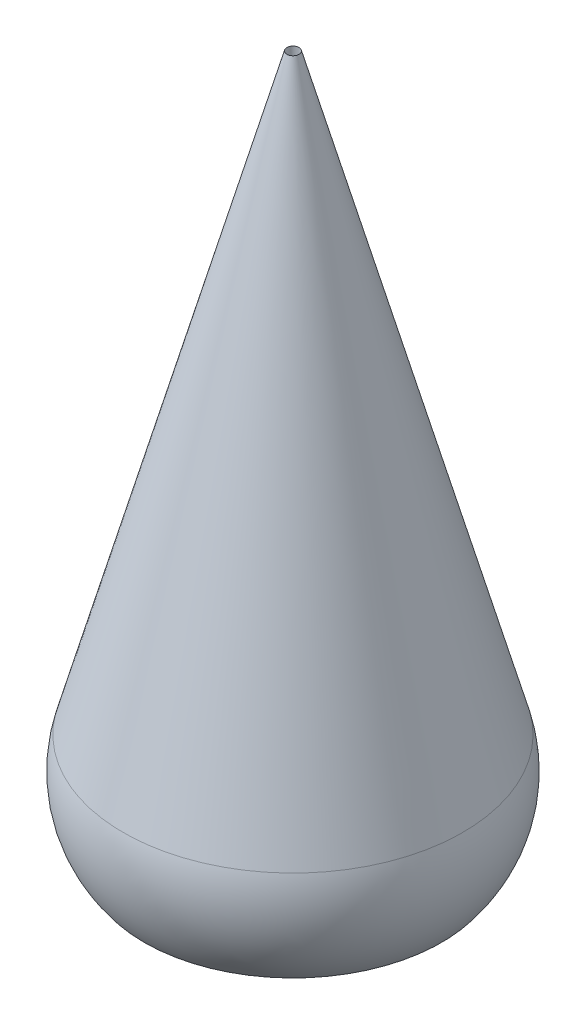
from build123d import *

# Parameters (mm, degrees)
FILLET1_R           = 10
SKETCH5_R           = 0.5
BOSS_EXTRUDE1_DEPTH = 60
CUT_EXTRUDE1_START  = -5
SKETCH7_R           = 0.5
CUT_EXTRUDE1_DEPTH  = 5


with BuildPart() as part:
    # Sketch3 → Revolve1 (revolve)
    with BuildSketch(Plane.XY, mode=Mode.PRIVATE) as revolve1_sk:
        Polygon((0, 60), (0, 44.835164835), (12.405575488, 0), (16.601578962, 0), align=None)
    revolve(revolve1_sk.sketch.rotate(Axis((0, 0, 0), (0, 1, 0)), 90), axis=Axis((0, 0, 0), (0, 1, 0)))

    # Fillet1
    # the kernel refuses this fillet: 10 mm, written as the material it takes off along each edge
    with BuildSketch(Plane(origin=(0, 0, 0), x_dir=(0, 0, -1), z_dir=(1, 0, 0))) as fillet1_piece_1:
        with BuildLine():
            CenterArc((4.523166195, 6.153667503), FILLET1_R, 322.021426145, 53.44496685)
            Line((12.405575488, 0), (12.563223674, -0.12307335))
            ThreePointArc((12.563223674, -0.12307335), (14.503577225, -0.2), (16.601578962, -0.2))
            Line((16.601578962, -0.2), (16.794336369, 0.053334622))
            Line((16.794336369, 0.053334622), (14.353793971, 8.873733224))
            Line((14.353793971, 8.873733224), (14.161036564, 8.820398602))
        make_face()
    revolve(axis=Axis((0, 0, 0), (0, 1, 0)), mode=Mode.SUBTRACT)

    # Sketch5 → Boss-Extrude1 (add)
    with BuildSketch(Plane(origin=(0, 0, 0), x_dir=(1, 0, 0), z_dir=(0, 1, 0))):
        with Locations(Location((0, 0, 0), (0, 0, 90))):
            Circle(SKETCH5_R)
    extrude(amount=BOSS_EXTRUDE1_DEPTH)

    # Sketch7 → Cut-Extrude1 (cut)
    with BuildSketch(Plane(origin=(0, 60, 0), x_dir=(1, 0, 0), z_dir=(0, 1, 0)).offset(CUT_EXTRUDE1_START)):
        with Locations(Location((0, 0, 0), (0, 0, 90))):
            Circle(SKETCH7_R)
    extrude(amount=CUT_EXTRUDE1_DEPTH, mode=Mode.SUBTRACT)


solid = part.part
